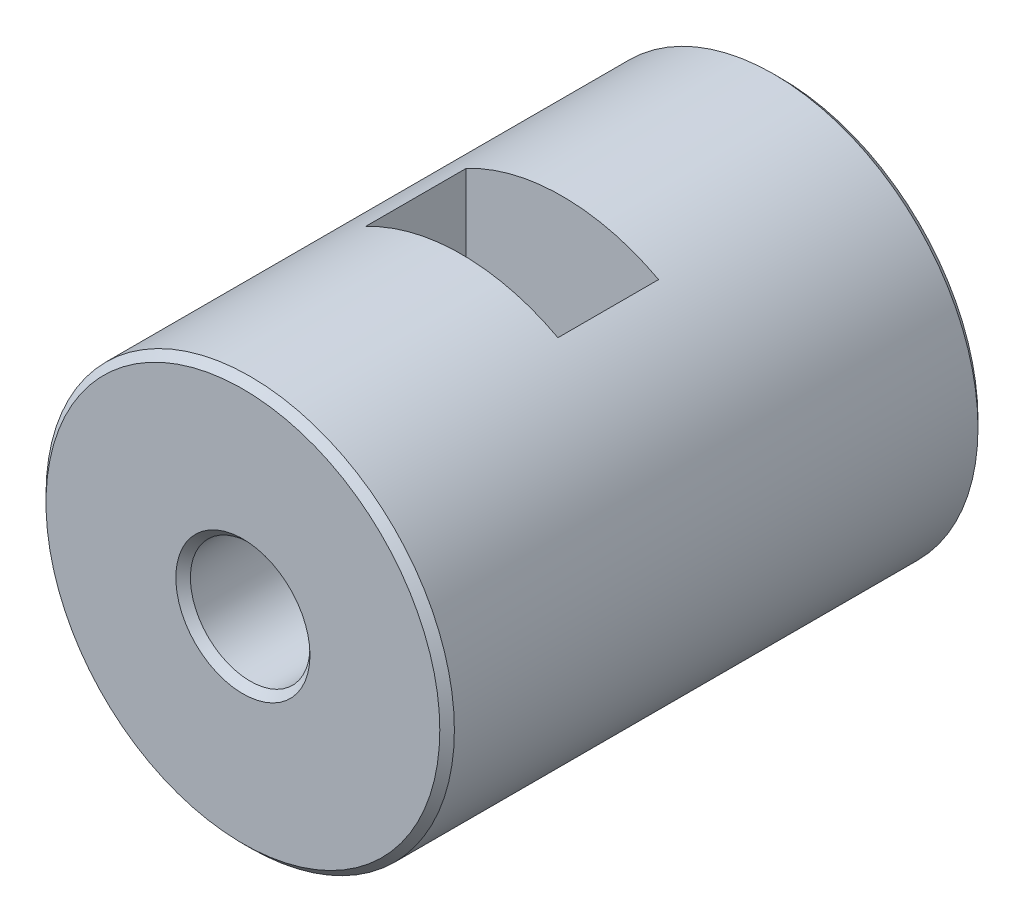
from build123d import *

# Parameters (mm, degrees)
SKETCH1_R           = 14
BOSS_EXTRUDE1_DEPTH = 15
BOSS_EXTRUDE2_DEPTH = 6.9
BOSS_EXTRUDE3_DEPTH = 15
SKETCH4_R           = 4.1
CUT_EXTRUDE1_DEPTH  = 42.876126850509955


with BuildPart() as part:
    # Sketch1 → Boss-Extrude1 (new body)
    with BuildSketch(Plane.XY):
        Circle(SKETCH1_R)
    extrude(amount=BOSS_EXTRUDE1_DEPTH)

    # Sketch2 → Boss-Extrude2 (add)
    with BuildSketch(Plane.XY.offset(15)):
        with BuildLine():
            Line((-6.600000000000001, 3.810511776651534), (-6.600000000000002, 12.34665946724052))
            ThreePointArc((-6.600000000000002, 12.34665946724052), (-2.57e-15, -14), (6.599999999999997, 12.34665946724052))
            Line((6.599999999999997, 12.34665946724052), (6.599999999999997, 3.695041722813614))
            Line((6.599999999999997, 3.695041722813614), (6.599999999999998, -3.810511776651528))
            Line((6.599999999999998, -3.810511776651528), (-1.31e-15, -7.62102355330306))
            Line((-1.31e-15, -7.62102355330306), (-6.600000000000001, -3.8105117766515293))
            Line((-6.600000000000001, -3.8105117766515293), (-6.600000000000001, 3.810511776651534))
        make_face()
    extrude(amount=BOSS_EXTRUDE2_DEPTH)

    # Sketch3 → Boss-Extrude3 (add)
    with BuildSketch(Plane.XY.offset(21.9)):
        with BuildLine():
            ThreePointArc((6.599999999999995, 12.346659467240523), (-2.25e-15, 13.999999999999998), (-6.600000000000002, 12.34665946724052))
            ThreePointArc((-6.600000000000002, 12.34665946724052), (-2.57e-15, -14), (6.599999999999995, 12.346659467240523))
        make_face()
    extrude(amount=BOSS_EXTRUDE3_DEPTH)

    # Sketch4 → Cut-Extrude1 (cut, through all)
    with BuildSketch(Plane.XY.offset(36.900000000000006)):
        Circle(SKETCH4_R)
    extrude(amount=-CUT_EXTRUDE1_DEPTH, mode=Mode.SUBTRACT)

    # Chamfer1
    # the kernel refuses this chamfer: 0.5 mm, written as the material it takes off along each edge
    with BuildSketch(Plane(origin=(0, 0, 0), x_dir=(1, 0, 0), z_dir=(0, -1, 0))) as chamfer1_piece_1:
        with BuildLine():
            Line((14.01414213562373, 0.5141421356237309), (13.48585786437627, -0.01414213562373095))
            Line((13.48585786437627, -0.01414213562373095), (13.48585786437627, -0.02414213562373095))
            ThreePointArc((13.48585786437627, -0.02414213562373095), (13.742928932188136, -0.01), (14, -0.01))
            Line((14, -0.01), (14.01, 0))
            ThreePointArc((14.01, 0), (14.01, 0.25707106781186545), (14.02414213562373, 0.5141421356237309))
            Line((14.02414213562373, 0.5141421356237309), (14.01414213562373, 0.5141421356237309))
        make_face()
    revolve(axis=Axis((0, 0, 0), (0, 0, 1)), mode=Mode.SUBTRACT)
    with BuildSketch(Plane(origin=(1.11e-15, 1.7e-16, 36.9), x_dir=(0.4714285714285716, 0.8819042476600372, 0), z_dir=(-0.8819042476600372, 0.4714285714285716, 0))) as chamfer1_piece_2:
        with BuildLine():
            Line((14.01414213562373, 0.5141421356237288), (13.48585786437627, -0.01414213562372879))
            Line((13.48585786437627, -0.01414213562372879), (13.48585786437627, -0.0241421356237268))
            ThreePointArc((13.48585786437627, -0.0241421356237268), (13.742928932188134, -0.00999999999999801), (14, -0.00999999999999801))
            Line((14, -0.00999999999999801), (14.01, 0))
            ThreePointArc((14.01, 0), (14.01, 0.2570710678118644), (14.02414213562373, 0.5141421356237288))
            Line((14.02414213562373, 0.5141421356237288), (14.01414213562373, 0.5141421356237288))
        make_face()
    revolve(axis=Axis((1.11e-15, 1.7e-16, 36.9), (0, 0, -1)), mode=Mode.SUBTRACT)
    with BuildSketch(Plane(origin=(0, 0, 0), x_dir=(1, 0, 0), z_dir=(0, -1, 0))) as chamfer1_piece_3:
        with BuildLine():
            Line((4.61414213562373, -0.01414213562373095), (4.085857864376269, 0.5141421356237309))
            Line((4.085857864376269, 0.5141421356237309), (4.075857864376269, 0.5141421356237309))
            ThreePointArc((4.075857864376269, 0.5141421356237309), (4.09, 0.2570710678118644), (4.09, 0))
            Line((4.09, 0), (4.1, -0.01))
            ThreePointArc((4.1, -0.01), (4.357071067811865, -0.01), (4.61414213562373, -0.02414213562373095))
            Line((4.61414213562373, -0.02414213562373095), (4.61414213562373, -0.01414213562373095))
        make_face()
    revolve(axis=Axis((0, 0, 0), (0, 0, 1)), mode=Mode.SUBTRACT)
    with BuildSketch(Plane(origin=(0, 0, 36.900000000000006), x_dir=(1, 0, 0), z_dir=(0, -1, 0))) as chamfer1_piece_4:
        with BuildLine():
            Line((4.614142135623731, 0.01414213562372169), (4.085857864376268, -0.5141421356237288))
            Line((4.085857864376268, -0.5141421356237288), (4.075857864376268, -0.5141421356237288))
            ThreePointArc((4.075857864376268, -0.5141421356237288), (4.09, -0.2570710678118644), (4.09, 0))
            Line((4.09, 0), (4.1, 0.00999999999999801))
            ThreePointArc((4.1, 0.00999999999999801), (4.357071067811866, 0.00999999999999091), (4.614142135623731, 0.0241421356237197))
            Line((4.614142135623731, 0.0241421356237197), (4.614142135623731, 0.01414213562372169))
        make_face()
    revolve(axis=Axis((0, 0, 36.900000000000006), (0, 0, 1)), mode=Mode.SUBTRACT)


solid = part.part
